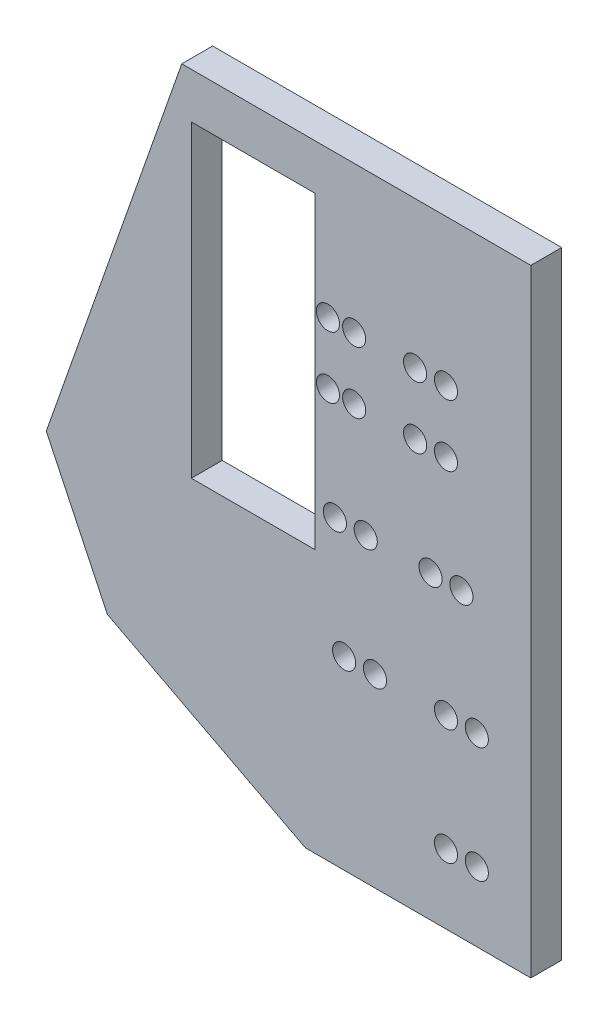
from build123d import *

# Parameters (mm, degrees)
BOSS_EXTRUDE1_DEPTH = 5.08
SKETCH4_R           = 1.905
SKETCH4_W           = 20.32
SKETCH4_H           = 50.8
CUT_EXTRUDE2_DEPTH  = 25.4


with BuildPart() as part:
    # Sketch1 → Boss-Extrude1 (new body)
    with BuildSketch(Plane.XY):
        Polygon((-4.120444444, 6.35), (53.34, 6.35), (53.34, -95.25), (16.22499019, -95.25), (-16.356614113, -78.274710363), (-26.416, -57.15), align=None)
    extrude(amount=BOSS_EXTRUDE1_DEPTH)

    # Sketch4 → Cut-Extrude2 (cut)
    with BuildSketch(Plane(origin=(0, 0, 0), x_dir=(-1, 0, 0), z_dir=(0, 0, -1))):
        with Locations((-39.37, -17.78)):
            Circle(SKETCH4_R)
        with Locations((-34.29, -17.78)):
            Circle(SKETCH4_R)
        with Locations((-39.37, -27.94)):
            Circle(SKETCH4_R)
        with Locations((-34.29, -27.94)):
            Circle(SKETCH4_R)
        with Locations((-41.91, -45.72)):
            Circle(SKETCH4_R)
        with Locations((-36.83, -45.72)):
            Circle(SKETCH4_R)
        with Locations((-44.45, -64.77)):
            Circle(SKETCH4_R)
        with Locations((-39.37, -64.77)):
            Circle(SKETCH4_R)
        with Locations((-44.45, -83.82)):
            Circle(SKETCH4_R)
        with Locations((-39.37, -83.82)):
            Circle(SKETCH4_R)
        with Locations((-24.257, -17.78)):
            Circle(SKETCH4_R)
        with Locations((-19.939, -17.78)):
            Circle(SKETCH4_R)
        with Locations((-24.257, -27.94)):
            Circle(SKETCH4_R)
        with Locations((-19.939, -27.94)):
            Circle(SKETCH4_R)
        with Locations((-26.162, -45.72)):
            Circle(SKETCH4_R)
        with Locations((-21.082, -45.72)):
            Circle(SKETCH4_R)
        with Locations((-27.686, -64.77)):
            Circle(SKETCH4_R)
        with Locations((-22.606, -64.77)):
            Circle(SKETCH4_R)
        with Locations((-7.62, -26.543)):
            Rectangle(SKETCH4_W, SKETCH4_H)
    extrude(amount=-CUT_EXTRUDE2_DEPTH, mode=Mode.SUBTRACT)


solid = part.part
